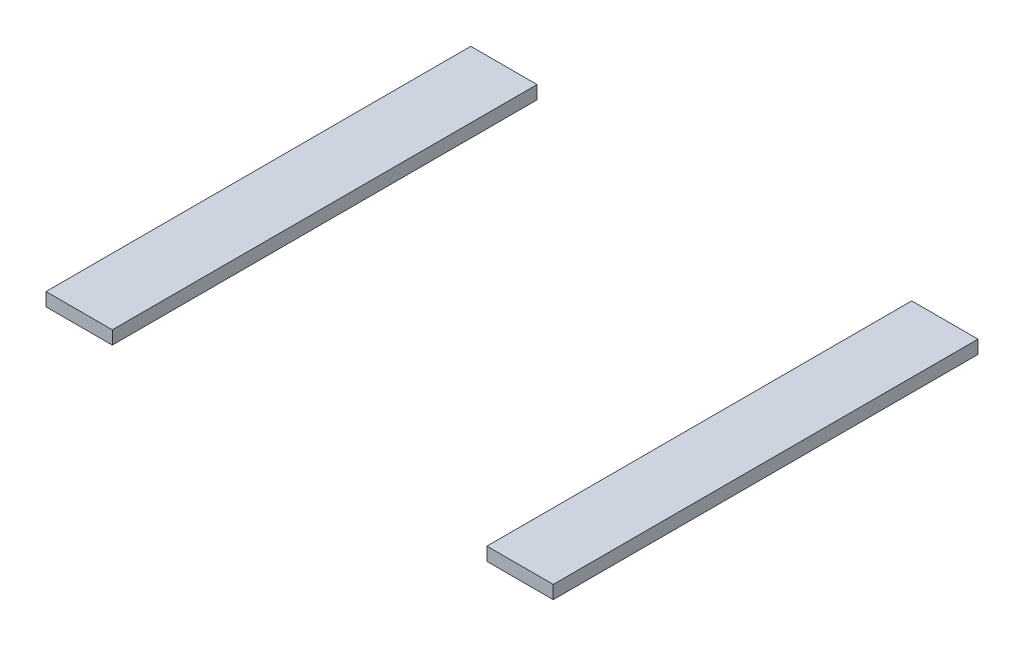
from build123d import *

# Parameters (mm, degrees)
EXTRUDE_1_OUTLINE_W = 50
EXTRUDE_1_OUTLINE_H = 10
EXTRUDE_1_DEPTH     = 320.4


# Read off the part's stored shape, not the designer's step: 填料-伸長1
with BuildPart() as part:
    # 填料-伸長1 outline → 填料-伸長1 (new body)
    with BuildSketch(Plane.XY):
        with Locations((-249.804738154, -19.040660553)):
            Rectangle(EXTRUDE_1_OUTLINE_W, EXTRUDE_1_OUTLINE_H)
        with Locations((82.793299874, -19.040660553)):
            Rectangle(EXTRUDE_1_OUTLINE_W, EXTRUDE_1_OUTLINE_H)
    extrude(amount=EXTRUDE_1_DEPTH)


solid = part.part
